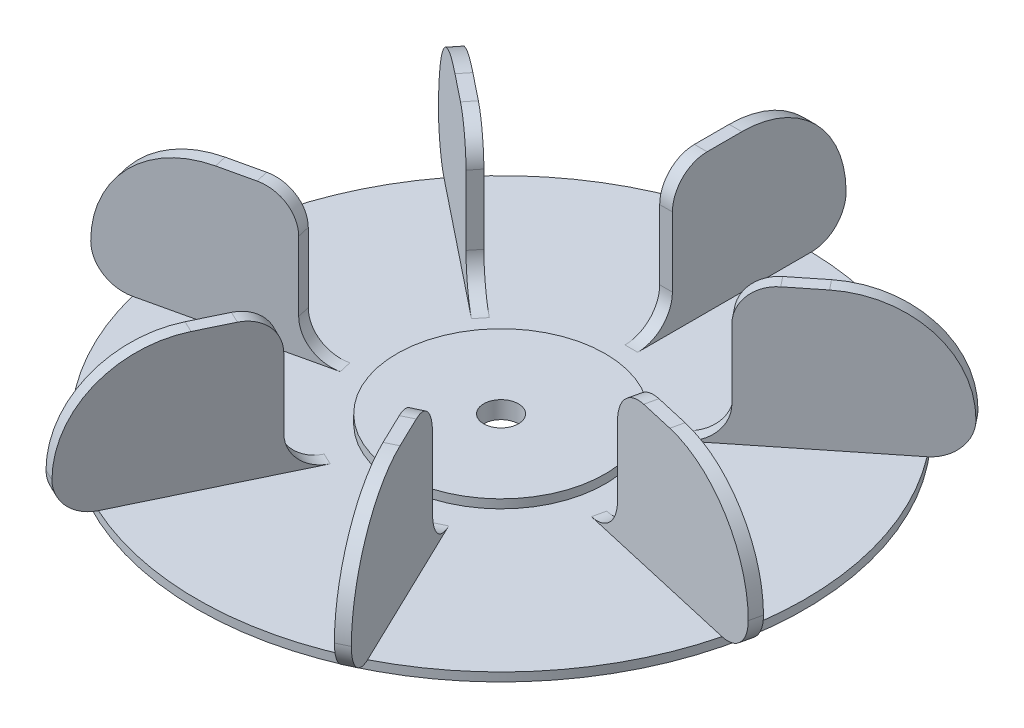
from build123d import *

# Parameters (mm, degrees)
SKETCH3_W                = 7.322640784
SKETCH3_H                = 100
BOSS_EXTRUDE1_DEPTH      = 80
FILLET1_R                = 60
FILLET2_R                = 20
FILLET3_R                = 20
FILLET4_R                = 20
CIRPATTERN2_COUNT        = 7
FILLET1_OF_CIRPATTERN2_R = 60
FILLET2_OF_CIRPATTERN2_R = 20
FILLET3_OF_CIRPATTERN2_R = 20
FILLET4_OF_CIRPATTERN2_R = 20


with BuildPart() as part:
    # Sketch2 → Revolve2 (revolve)
    with BuildSketch(Plane(origin=(0, 0, 0), x_dir=(0, 0, -1), z_dir=(1, 0, 0))):
        Polygon((32.860104606, 2), (10, 0), (10, 10), (60, 10), (60, 5), (175, 5), (175, 0), align=None)
    revolve(axis=Axis((0, 0, 0), (0, 1, 0)))

    # Sketch3 → Boss-Extrude1 (add)
    with BuildSketch(Plane(origin=(0, 5, 0), x_dir=(1, 0, 0), z_dir=(0, 1, 0))):
        with Locations((0, 145)):
            Rectangle(SKETCH3_W, SKETCH3_H)
    boss_extrude1 = extrude(amount=BOSS_EXTRUDE1_DEPTH)

    # Fillet1
    fillet1_edges = [part.edges().sort_by_distance(p)[0] for p in [
        (0, 85, -195),
    ]]
    fillet(fillet1_edges, radius=FILLET1_R)

    # Fillet2
    fillet2_edges = [part.edges().sort_by_distance(p)[0] for p in [
        (0, 5, -195),
    ]]
    fillet(fillet2_edges, radius=FILLET2_R - 0.0001)  # a hair under: the kernel refuses the full size

    # Fillet3
    fillet3_edges = [part.edges().sort_by_distance(p)[0] for p in [
        (0, 85, -95),
    ]]
    fillet(fillet3_edges, radius=FILLET3_R)

    # Fillet4
    fillet4_edges = [part.edges().sort_by_distance(p)[0] for p in [
        (0, 5, -95),
    ]]
    fillet(fillet4_edges, radius=FILLET4_R)

    # CirPattern2: Boss-Extrude1 ×7 about axis
    cirpattern2_axis = Axis((0, 0, 0), (0, 1, 0))
    for i in range(1, CIRPATTERN2_COUNT):
        add(boss_extrude1.rotate(cirpattern2_axis, i * 360 / CIRPATTERN2_COUNT))

    # Fillet1 of CirPattern2
    fillet1_of_cirpattern2_edges = [part.edges().sort_by_distance(p)[0] for p in [
        (-152.457139081, 85, -121.580511362),
        (-190.110942875, 85, 43.391582121),
        (-84.607329128, 85, 175.688929241),
        (84.607329128, 85, 175.688929241),
        (190.110942875, 85, 43.391582121),
        (152.457139081, 85, -121.580511362),
    ]]
    fillet(fillet1_of_cirpattern2_edges, radius=FILLET1_OF_CIRPATTERN2_R)

    # Fillet2 of CirPattern2
    fillet2_of_cirpattern2_edges = [part.edges().sort_by_distance(p)[0] for p in [
        (-152.457139081, 5, -121.580511362),
        (-190.110942875, 5, 43.391582121),
        (-84.607329128, 5, 175.688929241),
        (84.607329128, 5, 175.688929241),
        (190.110942875, 5, 43.391582121),
        (152.457139081, 5, -121.580511362),
    ]]
    fillet(fillet2_of_cirpattern2_edges, radius=FILLET2_OF_CIRPATTERN2_R - 0.0001)  # a hair under: the kernel refuses the full size

    # Fillet3 of CirPattern2
    fillet3_of_cirpattern2_edges = [part.edges().sort_by_distance(p)[0] for p in [
        (-74.273990834, 85, -59.231531177),
        (-92.618151657, 85, 21.139488726),
        (-41.218955216, 85, 85.592042451),
        (41.218955216, 85, 85.592042451),
        (92.618151657, 85, 21.139488726),
        (74.273990834, 85, -59.231531177),
    ]]
    fillet(fillet3_of_cirpattern2_edges, radius=FILLET3_OF_CIRPATTERN2_R)

    # Fillet4 of CirPattern2
    fillet4_of_cirpattern2_edges = [part.edges().sort_by_distance(p)[0] for p in [
        (-74.273990834, 5, -59.231531177),
        (-92.618151657, 5, 21.139488726),
        (-41.218955216, 5, 85.592042451),
        (41.218955216, 5, 85.592042451),
        (92.618151657, 5, 21.139488726),
        (74.273990834, 5, -59.231531177),
    ]]
    fillet(fillet4_of_cirpattern2_edges, radius=FILLET4_OF_CIRPATTERN2_R)


solid = part.part
